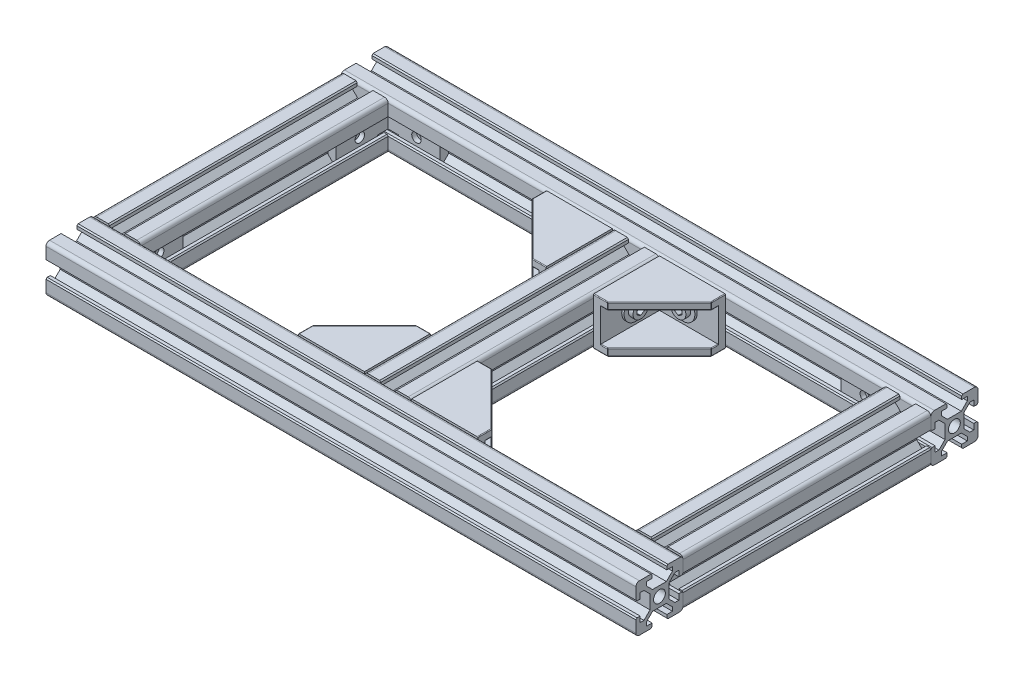
from build123d import *

# Parameters (mm, degrees)
EXTRUDE_1_DEPTH        = 52.5
EXTRUDE_1_DEPTH_BACK   = 52.5
SKETCH_1_R             = 2.5
EXTRUDE_2_DEPTH        = 52.5
EXTRUDE_2_DEPTH_BACK   = 52.5
SKETCH_2_R             = 2.5
EXTRUDE_2_2_DEPTH      = 52.5
EXTRUDE_2_2_DEPTH_BACK = 52.5
EXTRUDE_3_DEPTH        = 125
EXTRUDE_3_DEPTH_BACK   = 125
SKETCH_3_R             = 2.5
EXTRUDE_3_2_DEPTH      = 125
EXTRUDE_3_2_DEPTH_BACK = 125
SKETCH_4_R             = 1.5
CUT_EXTRUDE_1_DEPTH    = 8
EXTRUDE_4_DEPTH        = 10
EXTRUDE_4_DEPTH_BACK   = 10
SKETCH_6_W             = 25
SKETCH_6_H             = 14
CUT_EXTRUDE_2_DEPTH    = 25
FILLET_2_R             = 0.3
SKETCH_7_R             = 5
EXTRUDE_5_DEPTH        = 1
SKETCH_8_R             = 3.19259757
EXTRUDE_6_DEPTH        = 2
SKETCH_10_R            = 5
EXTRUDE_7_DEPTH        = 1
SKETCH_11_R            = 3.19259757
EXTRUDE_8_DEPTH        = 2
CUT_EXTRUDE_4_DEPTH    = 2
EXTRUDE_9_DEPTH        = 23.5
EXTRUDE_10_DEPTH       = 25.5
SKETCH_15_W            = 8
SKETCH_15_H            = 8
CUT_EXTRUDE_6_DEPTH    = 2.2
SKETCH_16_W            = 8
SKETCH_16_H            = 8
CUT_EXTRUDE_7_DEPTH    = 2.2
CUT_EXTRUDE_8_DEPTH    = 2
SKETCH_18_R            = 2
CUT_EXTRUDE_9_DEPTH    = 2
SKETCH_19_R            = 2
CUT_EXTRUDE_10_DEPTH   = 2
MOVE_BODY_1_ANGLE      = 180
MOVE_BODY_1_2_ANGLE    = 180
MOVE_BODY_1_3_ANGLE    = 180
MOVE_BODY_2_ANGLE      = 180
MOVE_BODY_2_2_ANGLE    = 180
MOVE_BODY_2_3_ANGLE    = 180
MOVE_BODY_3_ANGLE      = 180
MOVE_BODY_3_2_ANGLE    = 180
MOVE_BODY_3_3_ANGLE    = 180
MOVE_BODY_4_ANGLE      = 180
MOVE_BODY_5_ANGLE      = 180
MOVE_BODY_6_ANGLE      = 180


with BuildPart() as part:
    # 草图1 → 凸台-拉伸1 (new, two sides: drawn at the far end of the back side and taken through both)
    with BuildSketch(Plane.XY.offset(-EXTRUDE_1_DEPTH_BACK)):
        with BuildLine():
            Line((10, -3.6), (9.5, -3.1))
            Line((9.5, -3.1), (8.2, -3.1))
            Line((8.2, -3.1), (8.2, -5.5))
            Line((8.2, -5.5), (6.560660172, -5.5))
            Line((6.560660172, -5.5), (4, -2.939339828))
            Line((4, -2.939339828), (4, 2.939339828))
            Line((4, 2.939339828), (6.560660172, 5.5))
            Line((6.560660172, 5.5), (8.2, 5.5))
            Line((8.2, 5.5), (8.2, 3.1))
            Line((8.2, 3.1), (9.5, 3.1))
            Line((9.5, 3.1), (10, 3.6))
            Line((10, 3.6), (10, 8.5))
            ThreePointArc((10, 8.5), (9.560660172, 9.560660172), (8.5, 10))
            Line((8.5, 10), (3.6, 10))
            Line((3.6, 10), (3.1, 9.5))
            Line((3.1, 9.5), (3.1, 8.2))
            Line((3.1, 8.2), (5.5, 8.2))
            Line((5.5, 8.2), (5.5, 6.560660172))
            Line((5.5, 6.560660172), (2.939339828, 4))
            Line((2.939339828, 4), (-2.939339828, 4))
            Line((-2.939339828, 4), (-5.5, 6.560660172))
            Line((-5.5, 6.560660172), (-5.5, 8.2))
            Line((-5.5, 8.2), (-3.1, 8.2))
            Line((-3.1, 8.2), (-3.1, 9.5))
            Line((-3.1, 9.5), (-3.6, 10))
            Line((-3.6, 10), (-8.5, 10))
            ThreePointArc((-8.5, 10), (-9.560660172, 9.560660172), (-10, 8.5))
            Line((-10, 8.5), (-10, 3.6))
            Line((-10, 3.6), (-9.5, 3.1))
            Line((-9.5, 3.1), (-8.2, 3.1))
            Line((-8.2, 3.1), (-8.2, 5.5))
            Line((-8.2, 5.5), (-6.560660172, 5.5))
            Line((-6.560660172, 5.5), (-4, 2.939339828))
            Line((-4, 2.939339828), (-4, -2.939339828))
            Line((-4, -2.939339828), (-6.560660172, -5.5))
            Line((-6.560660172, -5.5), (-8.2, -5.5))
            Line((-8.2, -5.5), (-8.2, -3.1))
            Line((-8.2, -3.1), (-9.5, -3.1))
            Line((-9.5, -3.1), (-10, -3.6))
            Line((-10, -3.6), (-10, -8.5))
            ThreePointArc((-10, -8.5), (-9.560660172, -9.560660172), (-8.5, -10))
            Line((-8.5, -10), (-3.6, -10))
            Line((-3.6, -10), (-3.1, -9.5))
            Line((-3.1, -9.5), (-3.1, -8.2))
            Line((-3.1, -8.2), (-5.5, -8.2))
            Line((-5.5, -8.2), (-5.5, -6.560660172))
            Line((-5.5, -6.560660172), (-2.939339828, -4))
            Line((-2.939339828, -4), (2.939339828, -4))
            Line((2.939339828, -4), (5.5, -6.560660172))
            Line((5.5, -6.560660172), (5.5, -8.2))
            Line((5.5, -8.2), (3.1, -8.2))
            Line((3.1, -8.2), (3.1, -9.5))
            Line((3.1, -9.5), (3.6, -10))
            Line((3.6, -10), (8.5, -10))
            ThreePointArc((8.5, -10), (9.560660172, -9.560660172), (10, -8.5))
            Line((10, -8.5), (10, -3.6))
        make_face()
        Circle(SKETCH_1_R, mode=Mode.SUBTRACT)
    extrude(amount=EXTRUDE_1_DEPTH + EXTRUDE_1_DEPTH_BACK)

    # 草图4 → 切除-拉伸1 (cut)
    with BuildSketch(Plane(origin=(0, 4, 0), x_dir=(1, 0, 0), z_dir=(0, 1, 0))):
        with Locations(Location((0, 24.5, 0), (0, 0, 270))):
            Circle(SKETCH_4_R)
        with Locations(Location((0, -24.5, 0), (0, 0, 270))):
            Circle(SKETCH_4_R)
    extrude(amount=-CUT_EXTRUDE_1_DEPTH, mode=Mode.SUBTRACT)


with BuildPart() as body_2:
    # 草图2 → 凸台-拉伸2 (new, two sides: drawn at the far end of the back side and taken through both)
    with BuildSketch(Plane.XY.offset(-EXTRUDE_2_DEPTH_BACK)):
        with BuildLine():
            Line((-105, -3.6), (-105.5, -3.1))
            Line((-105.5, -3.1), (-106.8, -3.1))
            Line((-106.8, -3.1), (-106.8, -5.5))
            Line((-106.8, -5.5), (-108.439339828, -5.5))
            Line((-108.439339828, -5.5), (-111, -2.939339828))
            Line((-111, -2.939339828), (-111, 2.939339828))
            Line((-111, 2.939339828), (-108.439339828, 5.5))
            Line((-108.439339828, 5.5), (-106.8, 5.5))
            Line((-106.8, 5.5), (-106.8, 3.1))
            Line((-106.8, 3.1), (-105.5, 3.1))
            Line((-105.5, 3.1), (-105, 3.6))
            Line((-105, 3.6), (-105, 8.5))
            ThreePointArc((-105, 8.5), (-105.439339828, 9.560660172), (-106.5, 10))
            Line((-106.5, 10), (-111.4, 10))
            Line((-111.4, 10), (-111.9, 9.5))
            Line((-111.9, 9.5), (-111.9, 8.2))
            Line((-111.9, 8.2), (-109.5, 8.2))
            Line((-109.5, 8.2), (-109.5, 6.560660172))
            Line((-109.5, 6.560660172), (-112.060660172, 4))
            Line((-112.060660172, 4), (-117.939339828, 4))
            Line((-117.939339828, 4), (-120.5, 6.560660172))
            Line((-120.5, 6.560660172), (-120.5, 8.2))
            Line((-120.5, 8.2), (-118.1, 8.2))
            Line((-118.1, 8.2), (-118.1, 9.5))
            Line((-118.1, 9.5), (-118.6, 10))
            Line((-118.6, 10), (-123.5, 10))
            ThreePointArc((-123.5, 10), (-124.560660172, 9.560660172), (-125, 8.5))
            Line((-125, 8.5), (-125, 3.6))
            Line((-125, 3.6), (-124.5, 3.1))
            Line((-124.5, 3.1), (-123.2, 3.1))
            Line((-123.2, 3.1), (-123.2, 5.5))
            Line((-123.2, 5.5), (-121.560660172, 5.5))
            Line((-121.560660172, 5.5), (-119, 2.939339828))
            Line((-119, 2.939339828), (-119, -2.939339828))
            Line((-119, -2.939339828), (-121.560660172, -5.5))
            Line((-121.560660172, -5.5), (-123.2, -5.5))
            Line((-123.2, -5.5), (-123.2, -3.1))
            Line((-123.2, -3.1), (-124.5, -3.1))
            Line((-124.5, -3.1), (-125, -3.6))
            Line((-125, -3.6), (-125, -8.5))
            ThreePointArc((-125, -8.5), (-124.560660172, -9.560660172), (-123.5, -10))
            Line((-123.5, -10), (-118.6, -10))
            Line((-118.6, -10), (-118.1, -9.5))
            Line((-118.1, -9.5), (-118.1, -8.2))
            Line((-118.1, -8.2), (-120.5, -8.2))
            Line((-120.5, -8.2), (-120.5, -6.560660172))
            Line((-120.5, -6.560660172), (-117.939339828, -4))
            Line((-117.939339828, -4), (-112.060660172, -4))
            Line((-112.060660172, -4), (-109.5, -6.560660172))
            Line((-109.5, -6.560660172), (-109.5, -8.2))
            Line((-109.5, -8.2), (-111.9, -8.2))
            Line((-111.9, -8.2), (-111.9, -9.5))
            Line((-111.9, -9.5), (-111.4, -10))
            Line((-111.4, -10), (-106.5, -10))
            ThreePointArc((-106.5, -10), (-105.439339828, -9.560660172), (-105, -8.5))
            Line((-105, -8.5), (-105, -3.6))
        make_face()
        with Locations((-115, 0)):
            Circle(SKETCH_2_R, mode=Mode.SUBTRACT)
    extrude(amount=EXTRUDE_2_DEPTH + EXTRUDE_2_DEPTH_BACK)


with BuildPart() as body_3:
    # 草图2 → Extrude 2 2 (new, two sides: drawn at the far end of the back side and taken through both)
    with BuildSketch(Plane.XY.offset(-EXTRUDE_2_2_DEPTH_BACK)):
        with BuildLine():
            Line((125, -3.6), (124.5, -3.1))
            Line((124.5, -3.1), (123.2, -3.1))
            Line((123.2, -3.1), (123.2, -5.5))
            Line((123.2, -5.5), (121.560660172, -5.5))
            Line((121.560660172, -5.5), (119, -2.939339828))
            Line((119, -2.939339828), (119, 2.939339828))
            Line((119, 2.939339828), (121.560660172, 5.5))
            Line((121.560660172, 5.5), (123.2, 5.5))
            Line((123.2, 5.5), (123.2, 3.1))
            Line((123.2, 3.1), (124.5, 3.1))
            Line((124.5, 3.1), (125, 3.6))
            Line((125, 3.6), (125, 8.5))
            ThreePointArc((125, 8.5), (124.560660172, 9.560660172), (123.5, 10))
            Line((123.5, 10), (118.6, 10))
            Line((118.6, 10), (118.1, 9.5))
            Line((118.1, 9.5), (118.1, 8.2))
            Line((118.1, 8.2), (120.5, 8.2))
            Line((120.5, 8.2), (120.5, 6.560660172))
            Line((120.5, 6.560660172), (117.939339828, 4))
            Line((117.939339828, 4), (112.060660172, 4))
            Line((112.060660172, 4), (109.5, 6.560660172))
            Line((109.5, 6.560660172), (109.5, 8.2))
            Line((109.5, 8.2), (111.9, 8.2))
            Line((111.9, 8.2), (111.9, 9.5))
            Line((111.9, 9.5), (111.4, 10))
            Line((111.4, 10), (106.5, 10))
            ThreePointArc((106.5, 10), (105.439339828, 9.560660172), (105, 8.5))
            Line((105, 8.5), (105, 3.6))
            Line((105, 3.6), (105.5, 3.1))
            Line((105.5, 3.1), (106.8, 3.1))
            Line((106.8, 3.1), (106.8, 5.5))
            Line((106.8, 5.5), (108.439339828, 5.5))
            Line((108.439339828, 5.5), (111, 2.939339828))
            Line((111, 2.939339828), (111, -2.939339828))
            Line((111, -2.939339828), (108.439339828, -5.5))
            Line((108.439339828, -5.5), (106.8, -5.5))
            Line((106.8, -5.5), (106.8, -3.1))
            Line((106.8, -3.1), (105.5, -3.1))
            Line((105.5, -3.1), (105, -3.6))
            Line((105, -3.6), (105, -8.5))
            ThreePointArc((105, -8.5), (105.439339828, -9.560660172), (106.5, -10))
            Line((106.5, -10), (111.4, -10))
            Line((111.4, -10), (111.9, -9.5))
            Line((111.9, -9.5), (111.9, -8.2))
            Line((111.9, -8.2), (109.5, -8.2))
            Line((109.5, -8.2), (109.5, -6.560660172))
            Line((109.5, -6.560660172), (112.060660172, -4))
            Line((112.060660172, -4), (117.939339828, -4))
            Line((117.939339828, -4), (120.5, -6.560660172))
            Line((120.5, -6.560660172), (120.5, -8.2))
            Line((120.5, -8.2), (118.1, -8.2))
            Line((118.1, -8.2), (118.1, -9.5))
            Line((118.1, -9.5), (118.6, -10))
            Line((118.6, -10), (123.5, -10))
            ThreePointArc((123.5, -10), (124.560660172, -9.560660172), (125, -8.5))
            Line((125, -8.5), (125, -3.6))
        make_face()
        with Locations((115, 0)):
            Circle(SKETCH_2_R, mode=Mode.SUBTRACT)
    extrude(amount=EXTRUDE_2_2_DEPTH + EXTRUDE_2_2_DEPTH_BACK)


with BuildPart() as body_4:
    # 草图3 → 凸台-拉伸3 (new, two sides: drawn at the far end of the back side and taken through both)
    with BuildSketch(Plane(origin=(0, 0, 0), x_dir=(0, 0, -1), z_dir=(1, 0, 0)).offset(-EXTRUDE_3_DEPTH_BACK)):
        with BuildLine():
            Line((-52.501, -3.6), (-53.001, -3.1))
            Line((-53.001, -3.1), (-54.301, -3.1))
            Line((-54.301, -3.1), (-54.301, -5.5))
            Line((-54.301, -5.5), (-55.940339828, -5.5))
            Line((-55.940339828, -5.5), (-58.501, -2.939339828))
            Line((-58.501, -2.939339828), (-58.501, 2.939339828))
            Line((-58.501, 2.939339828), (-55.940339828, 5.5))
            Line((-55.940339828, 5.5), (-54.301, 5.5))
            Line((-54.301, 5.5), (-54.301, 3.1))
            Line((-54.301, 3.1), (-53.001, 3.1))
            Line((-53.001, 3.1), (-52.501, 3.6))
            Line((-52.501, 3.6), (-52.501, 8.5))
            ThreePointArc((-52.501, 8.5), (-52.940339828, 9.560660172), (-54.001, 10))
            Line((-54.001, 10), (-58.901, 10))
            Line((-58.901, 10), (-59.401, 9.5))
            Line((-59.401, 9.5), (-59.401, 8.2))
            Line((-59.401, 8.2), (-57.001, 8.2))
            Line((-57.001, 8.2), (-57.001, 6.560660172))
            Line((-57.001, 6.560660172), (-59.561660172, 4))
            Line((-59.561660172, 4), (-65.440339828, 4))
            Line((-65.440339828, 4), (-68.001, 6.560660172))
            Line((-68.001, 6.560660172), (-68.001, 8.2))
            Line((-68.001, 8.2), (-65.601, 8.2))
            Line((-65.601, 8.2), (-65.601, 9.5))
            Line((-65.601, 9.5), (-66.101, 10))
            Line((-66.101, 10), (-71.001, 10))
            ThreePointArc((-71.001, 10), (-72.061660172, 9.560660172), (-72.501, 8.5))
            Line((-72.501, 8.5), (-72.501, 3.6))
            Line((-72.501, 3.6), (-72.001, 3.1))
            Line((-72.001, 3.1), (-70.701, 3.1))
            Line((-70.701, 3.1), (-70.701, 5.5))
            Line((-70.701, 5.5), (-69.061660172, 5.5))
            Line((-69.061660172, 5.5), (-66.501, 2.939339828))
            Line((-66.501, 2.939339828), (-66.501, -2.939339828))
            Line((-66.501, -2.939339828), (-69.061660172, -5.5))
            Line((-69.061660172, -5.5), (-70.701, -5.5))
            Line((-70.701, -5.5), (-70.701, -3.1))
            Line((-70.701, -3.1), (-72.001, -3.1))
            Line((-72.001, -3.1), (-72.501, -3.6))
            Line((-72.501, -3.6), (-72.501, -8.5))
            ThreePointArc((-72.501, -8.5), (-72.061660172, -9.560660172), (-71.001, -10))
            Line((-71.001, -10), (-66.101, -10))
            Line((-66.101, -10), (-65.601, -9.5))
            Line((-65.601, -9.5), (-65.601, -8.2))
            Line((-65.601, -8.2), (-68.001, -8.2))
            Line((-68.001, -8.2), (-68.001, -6.560660172))
            Line((-68.001, -6.560660172), (-65.440339828, -4))
            Line((-65.440339828, -4), (-59.561660172, -4))
            Line((-59.561660172, -4), (-57.001, -6.560660172))
            Line((-57.001, -6.560660172), (-57.001, -8.2))
            Line((-57.001, -8.2), (-59.401, -8.2))
            Line((-59.401, -8.2), (-59.401, -9.5))
            Line((-59.401, -9.5), (-58.901, -10))
            Line((-58.901, -10), (-54.001, -10))
            ThreePointArc((-54.001, -10), (-52.940339828, -9.560660172), (-52.501, -8.5))
            Line((-52.501, -8.5), (-52.501, -3.6))
        make_face()
        with Locations((-62.501, 0)):
            Circle(SKETCH_3_R, mode=Mode.SUBTRACT)
    extrude(amount=EXTRUDE_3_DEPTH + EXTRUDE_3_DEPTH_BACK)


with BuildPart() as body_5:
    # 草图3 → Extrude 3 2 (new, two sides: drawn at the far end of the back side and taken through both)
    with BuildSketch(Plane(origin=(0, 0, 0), x_dir=(0, 0, -1), z_dir=(1, 0, 0)).offset(-EXTRUDE_3_2_DEPTH_BACK)):
        with BuildLine():
            Line((72.501, -3.6), (72.001, -3.1))
            Line((72.001, -3.1), (70.701, -3.1))
            Line((70.701, -3.1), (70.701, -5.5))
            Line((70.701, -5.5), (69.061660172, -5.5))
            Line((69.061660172, -5.5), (66.501, -2.939339828))
            Line((66.501, -2.939339828), (66.501, 2.939339828))
            Line((66.501, 2.939339828), (69.061660172, 5.5))
            Line((69.061660172, 5.5), (70.701, 5.5))
            Line((70.701, 5.5), (70.701, 3.1))
            Line((70.701, 3.1), (72.001, 3.1))
            Line((72.001, 3.1), (72.501, 3.6))
            Line((72.501, 3.6), (72.501, 8.5))
            ThreePointArc((72.501, 8.5), (72.061660172, 9.560660172), (71.001, 10))
            Line((71.001, 10), (66.101, 10))
            Line((66.101, 10), (65.601, 9.5))
            Line((65.601, 9.5), (65.601, 8.2))
            Line((65.601, 8.2), (68.001, 8.2))
            Line((68.001, 8.2), (68.001, 6.560660172))
            Line((68.001, 6.560660172), (65.440339828, 4))
            Line((65.440339828, 4), (59.561660172, 4))
            Line((59.561660172, 4), (57.001, 6.560660172))
            Line((57.001, 6.560660172), (57.001, 8.2))
            Line((57.001, 8.2), (59.401, 8.2))
            Line((59.401, 8.2), (59.401, 9.5))
            Line((59.401, 9.5), (58.901, 10))
            Line((58.901, 10), (54.001, 10))
            ThreePointArc((54.001, 10), (52.940339828, 9.560660172), (52.501, 8.5))
            Line((52.501, 8.5), (52.501, 3.6))
            Line((52.501, 3.6), (53.001, 3.1))
            Line((53.001, 3.1), (54.301, 3.1))
            Line((54.301, 3.1), (54.301, 5.5))
            Line((54.301, 5.5), (55.940339828, 5.5))
            Line((55.940339828, 5.5), (58.501, 2.939339828))
            Line((58.501, 2.939339828), (58.501, -2.939339828))
            Line((58.501, -2.939339828), (55.940339828, -5.5))
            Line((55.940339828, -5.5), (54.301, -5.5))
            Line((54.301, -5.5), (54.301, -3.1))
            Line((54.301, -3.1), (53.001, -3.1))
            Line((53.001, -3.1), (52.501, -3.6))
            Line((52.501, -3.6), (52.501, -8.5))
            ThreePointArc((52.501, -8.5), (52.940339828, -9.560660172), (54.001, -10))
            Line((54.001, -10), (58.901, -10))
            Line((58.901, -10), (59.401, -9.5))
            Line((59.401, -9.5), (59.401, -8.2))
            Line((59.401, -8.2), (57.001, -8.2))
            Line((57.001, -8.2), (57.001, -6.560660172))
            Line((57.001, -6.560660172), (59.561660172, -4))
            Line((59.561660172, -4), (65.440339828, -4))
            Line((65.440339828, -4), (68.001, -6.560660172))
            Line((68.001, -6.560660172), (68.001, -8.2))
            Line((68.001, -8.2), (65.601, -8.2))
            Line((65.601, -8.2), (65.601, -9.5))
            Line((65.601, -9.5), (66.101, -10))
            Line((66.101, -10), (71.001, -10))
            ThreePointArc((71.001, -10), (72.061660172, -9.560660172), (72.501, -8.5))
            Line((72.501, -8.5), (72.501, -3.6))
        make_face()
        with Locations((62.501, 0)):
            Circle(SKETCH_3_R, mode=Mode.SUBTRACT)
    extrude(amount=EXTRUDE_3_2_DEPTH + EXTRUDE_3_2_DEPTH_BACK)


with BuildPart() as body_6:
    # 草图5 → 凸台-拉伸4 (new, two sides: drawn at the far end of the back side and taken through both)
    with BuildSketch(Plane(origin=(0, 0, 0), x_dir=(1, 0, 0), z_dir=(0, 1, 0)).offset(-EXTRUDE_4_DEPTH_BACK)):
        Polygon((10.001, -52.5), (38.001, -52.5), (38.001, -46.5), (16.001, -24.5), (10.001, -24.5), align=None)
    extrude(amount=EXTRUDE_4_DEPTH + EXTRUDE_4_DEPTH_BACK)

    # 草图6 → 切除-拉伸2 (cut)
    with BuildSketch(Plane(origin=(0, 0, 24.5), x_dir=(-1, 0, 0), z_dir=(0, 0, -1))):
        with Locations((-25.501, 0)):
            Rectangle(SKETCH_6_W, SKETCH_6_H)
    extrude(amount=-CUT_EXTRUDE_2_DEPTH, mode=Mode.SUBTRACT)

    # 圆角2
    fillet_2_edges = [body_6.edges().sort_by_distance(p)[0] for p in [
        (38.001, -10, 49.5),
        (38.001, 10, 49.5),
        (27.001, 10, 35.5),
        (13.001, 10, 24.5),
        (27.001, -10, 35.5),
        (13.001, -10, 24.5),
        (38.001, 8.5, 46.5),
        (16.001, 8.5, 24.5),
        (27.001, 7, 35.5),
        (27.001, -7, 35.5),
        (38.001, -7, 48),
        (38.001, 7, 48),
        (14.501, -7, 24.5),
        (14.501, 7, 24.5),
        (16.001, -8.5, 24.5),
        (38.001, -8.5, 46.5),
    ]]
    fillet(fillet_2_edges, radius=FILLET_2_R)

    # 草图10 → 凸台-拉伸7 (add)
    with BuildSketch(Plane(origin=(0, 0, 49.5), x_dir=(-1, 0, 0), z_dir=(0, 0, -1))):
        with Locations((-24.001, 0)):
            Circle(SKETCH_10_R)
    extrude(amount=EXTRUDE_7_DEPTH)

    # 草图11 → 凸台-拉伸8 (add)
    with BuildSketch(Plane(origin=(0, 0, 48.5), x_dir=(-1, 0, 0), z_dir=(0, 0, -1))):
        with Locations((-24.001, 0)):
            Circle(SKETCH_11_R)
    extrude(amount=EXTRUDE_8_DEPTH)

    # 草图12 → 切除-拉伸4 (cut)
    with BuildSketch(Plane(origin=(0, 0, 46.5), x_dir=(-1, 0, 0), z_dir=(0, 0, -1))):
        Polygon((-24.001, 1.863827421), (-25.615121895, 0.93191371), (-25.615121895, -0.93191371), (-24.001, -1.863827421), (-22.386878105, -0.93191371), (-22.386878105, 0.93191371), align=None)
    extrude(amount=-CUT_EXTRUDE_4_DEPTH, mode=Mode.SUBTRACT)


with BuildPart() as body_7:
    # 草图7 → 凸台-拉伸5 (new body)
    with BuildSketch(Plane(origin=(13.001, 0, 0), x_dir=(0, 0, -1), z_dir=(1, 0, 0))):
        with Locations((-38.5, 0)):
            Circle(SKETCH_7_R)
    extrude(amount=EXTRUDE_5_DEPTH)


with BuildPart() as body_8:
    # 草图8 → 凸台-拉伸6 (new body)
    with BuildSketch(Plane(origin=(14.001, 0, 0), x_dir=(0, 0, -1), z_dir=(1, 0, 0))):
        with Locations((-38.5, 0)):
            Circle(SKETCH_8_R)
    extrude(amount=EXTRUDE_6_DEPTH)

    # 草图17 → 切除-拉伸8 (cut)
    with BuildSketch(Plane(origin=(16.001, 0, 0), x_dir=(0, 0, -1), z_dir=(1, 0, 0))):
        Polygon((-38.5, 1.863827421), (-40.114121895, 0.93191371), (-40.114121895, -0.93191371), (-38.5, -1.863827421), (-36.885878105, -0.93191371), (-36.885878105, 0.93191371), align=None)
    extrude(amount=-CUT_EXTRUDE_8_DEPTH, mode=Mode.SUBTRACT)


with BuildPart() as body_9:
    # 草图13 → 凸台-拉伸9 (new body)
    with BuildSketch(Plane(origin=(85, 0, 0), x_dir=(0, 0, -1), z_dir=(1, 0, 0))):
        Polygon((-54.501, 5.1), (-55.801, 5.1), (-58.001, 2.9), (-58.001, -2.9), (-55.801, -5.1), (-54.501, -5.1), align=None)
    extrude(amount=EXTRUDE_9_DEPTH)

    # 草图14 → 凸台-拉伸10 (add)
    with BuildSketch(Plane.XY.offset(32.5)):
        Polygon((110.5, 2.9), (110.5, -2.9), (108.3, -5.1), (107, -5.1), (107, 5.1), (108.3, 5.1), align=None)
    extrude(amount=EXTRUDE_10_DEPTH)

    # 草图15 → 切除-拉伸6 (cut)
    with BuildSketch(Plane(origin=(0, 5.1, 0), x_dir=(1, 0, 0), z_dir=(0, 1, 0))):
        with Locations((106.5, -54)):
            Rectangle(SKETCH_15_W, SKETCH_15_H)
    extrude(amount=-CUT_EXTRUDE_6_DEPTH, mode=Mode.SUBTRACT)

    # 草图16 → 切除-拉伸7 (cut)
    with BuildSketch(Plane.XZ.offset(5.1)):
        with Locations((106.5, 54)):
            Rectangle(SKETCH_16_W, SKETCH_16_H)
    extrude(amount=-CUT_EXTRUDE_7_DEPTH, mode=Mode.SUBTRACT)

    # 草图18 → 切除-拉伸9 (cut)
    with BuildSketch(Plane(origin=(0, 0, 54.501), x_dir=(-1, 0, 0), z_dir=(0, 0, -1))):
        with Locations((-95, 0)):
            Circle(SKETCH_18_R)
    extrude(amount=-CUT_EXTRUDE_9_DEPTH, mode=Mode.SUBTRACT)

    # 草图19 → 切除-拉伸10 (cut)
    with BuildSketch(Plane.ZY.offset(-107)):
        with Locations((42.5, 0)):
            Circle(SKETCH_19_R)
    extrude(amount=-CUT_EXTRUDE_10_DEPTH, mode=Mode.SUBTRACT)


with BuildPart() as body_10:
    # Move Body 1: read off the stored shape, not the designer's step
    # Move Body 1: copy of body 8
    add(body_8.part.rotate(Axis((0, 0, 0), (1, 0, 0)), MOVE_BODY_1_ANGLE))


with BuildPart() as body_11:
    # Move Body 1 2: copy of body 7
    add(body_7.part.rotate(Axis((0, 0, 0), (1, 0, 0)), MOVE_BODY_1_2_ANGLE))


with BuildPart() as body_12:
    # Move Body 1 3: copy of body 6
    add(body_6.part.rotate(Axis((0, 0, 0), (1, 0, 0)), MOVE_BODY_1_3_ANGLE))


with BuildPart() as body_13:
    # Move Body 2: read off the stored shape, not the designer's step
    # Move Body 2: copy of body 10
    add(body_10.part.rotate(Axis((0, 0, 0), (0, 1, 0)), MOVE_BODY_2_ANGLE))


with BuildPart() as body_14:
    # Move Body 2 2: copy of body 11
    add(body_11.part.rotate(Axis((0, 0, 0), (0, 1, 0)), MOVE_BODY_2_2_ANGLE))


with BuildPart() as body_15:
    # Move Body 2 3: copy of body 12
    add(body_12.part.rotate(Axis((0, 0, 0), (0, 1, 0)), MOVE_BODY_2_3_ANGLE))


with BuildPart() as body_16:
    # Move Body 3: read off the stored shape, not the designer's step
    # Move Body 3: copy of body 15
    add(body_15.part.rotate(Axis((0, 0, 0), (1, 0, 0)), MOVE_BODY_3_ANGLE))


with BuildPart() as body_17:
    # Move Body 3 2: copy of body 13
    add(body_13.part.rotate(Axis((0, 0, 0), (1, 0, 0)), MOVE_BODY_3_2_ANGLE))


with BuildPart() as body_18:
    # Move Body 3 3: copy of body 14
    add(body_14.part.rotate(Axis((0, 0, 0), (1, 0, 0)), MOVE_BODY_3_3_ANGLE))


with BuildPart() as body_19:
    # Move Body 4: copy of body 9
    add(body_9.part.rotate(Axis((0, 0, 0), (1, 0, 0)), MOVE_BODY_4_ANGLE))


with BuildPart() as body_20:
    # Move Body 5: copy of body 9
    add(body_9.part.rotate(Axis((0, 0, 0), (0, 0, 1)), MOVE_BODY_5_ANGLE))


with BuildPart() as body_21:
    # Move Body 6: copy of body 20
    add(body_20.part.rotate(Axis((0, 0, 0), (1, 0, 0)), MOVE_BODY_6_ANGLE))


solid = Compound([part.part, body_2.part, body_3.part, body_4.part, body_5.part, body_6.part, body_7.part, body_8.part, body_9.part, body_10.part, body_11.part, body_12.part, body_13.part, body_14.part, body_15.part, body_16.part, body_17.part, body_18.part, body_19.part, body_20.part, body_21.part])
